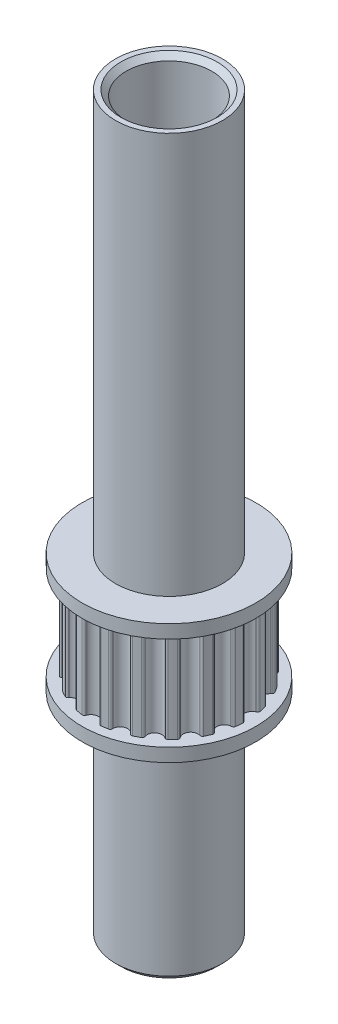
from build123d import *

# Parameters (mm, degrees)
SKETCH1_R           = 4
SKETCH1_R_2         = 3.2
BOSS_EXTRUDE1_DEPTH = 55
SKETCH2_R           = 6
SKETCH2_R_2         = 4
BOSS_EXTRUDE2_DEPTH = 7
SKETCH3_R           = 6.5
SKETCH3_R_2         = 4
BOSS_EXTRUDE3_DEPTH = 1
CUT_EXTRUDE1_DEPTH  = 7
CIRPATTERN1_COUNT   = 19
SKETCH4_R           = 6.5
SKETCH4_R_2         = 4
BOSS_EXTRUDE4_DEPTH = 1
CHAMFER1_SIZE       = 0.4
CHAMFER2_SIZE       = 0.4


with BuildPart() as part:
    # Sketch1 → Boss-Extrude1 (new body)
    with BuildSketch(Plane(origin=(0, 0, 0), x_dir=(1, 0, 0), z_dir=(0, 1, 0))):
        Circle(SKETCH1_R)
        Circle(SKETCH1_R_2, mode=Mode.SUBTRACT)
    extrude(amount=BOSS_EXTRUDE1_DEPTH)

    # Sketch2 → Boss-Extrude2 (add)
    with BuildSketch(Plane(origin=(0, 17, 0), x_dir=(1, 0, 0), z_dir=(0, 1, 0))):
        Circle(SKETCH2_R)
        Circle(SKETCH2_R_2, mode=Mode.SUBTRACT)
    extrude(amount=BOSS_EXTRUDE2_DEPTH)

    # Sketch6 → Cut-Extrude1 (cut)
    with BuildSketch(Plane(origin=(0, 17, 0), x_dir=(1, 0, 0), z_dir=(0, 1, 0))):
        with BuildLine():
            Line((0, 6.615527095), (0, 5.795))
            ThreePointArc((0, 5.795), (0.149150627, 5.793080277), (0.298202436, 5.787322378))
            ThreePointArc((0.298202436, 5.787322378), (0.391677024, 5.748245546), (0.438987206, 5.658656239))
            ThreePointArc((0.438987206, 5.658656239), (0.444862649, 5.622209456), (0.452079377, 5.586004378))
            ThreePointArc((0.452079377, 5.586004378), (0.898978771, 5.157769008), (1.464404105, 5.409560175))
            ThreePointArc((1.464404105, 5.409560175), (1.483443985, 5.44118883), (1.501303443, 5.473498714))
            ThreePointArc((1.501303443, 5.473498714), (1.576133246, 5.541799504), (1.677316186, 5.546948297))
            ThreePointArc((1.677316186, 5.546948297), (1.819526857, 5.501940296), (1.960532009, 5.453287013))
            Line((1.960532009, 5.453287013), (2.23812815, 6.225430197))
            ThreePointArc((2.23812815, 6.225430197), (1.13593499, 6.517273237), (0, 6.615527095))
        make_face()
    cut_extrude1 = extrude(amount=CUT_EXTRUDE1_DEPTH, mode=Mode.SUBTRACT)

    # CirPattern1: Cut-Extrude1 ×19 about axis
    cirpattern1_axis = Axis((0, 55, 0), (0, -1, 0))
    for i in range(1, CIRPATTERN1_COUNT):
        add(cut_extrude1.rotate(cirpattern1_axis, i * 360 / CIRPATTERN1_COUNT), mode=Mode.SUBTRACT)

    # Sketch4 → Boss-Extrude4 (add)
    with BuildSketch(Plane(origin=(0, 24, 0), x_dir=(1, 0, 0), z_dir=(0, 1, 0))):
        Circle(SKETCH4_R)
        Circle(SKETCH4_R_2, mode=Mode.SUBTRACT)
    extrude(amount=BOSS_EXTRUDE4_DEPTH)

    # Chamfer1
    chamfer1_edges = [part.edges().sort_by_distance(p)[0] for p in [
        (-4, 0, 0),
    ]]
    chamfer(chamfer1_edges, length=CHAMFER1_SIZE)

    # Chamfer2
    chamfer2_edges = [part.edges().sort_by_distance(p)[0] for p in [
        (-3.2, 55, 0),
    ]]
    chamfer(chamfer2_edges, length=CHAMFER2_SIZE)


with BuildPart() as body_2:
    # Sketch3 → Boss-Extrude3 (new body)
    with BuildSketch(Plane.XZ.offset(-17)):
        Circle(SKETCH3_R)
        Circle(SKETCH3_R_2, mode=Mode.SUBTRACT)
    extrude(amount=BOSS_EXTRUDE3_DEPTH)


solid = Compound([part.part, body_2.part])
